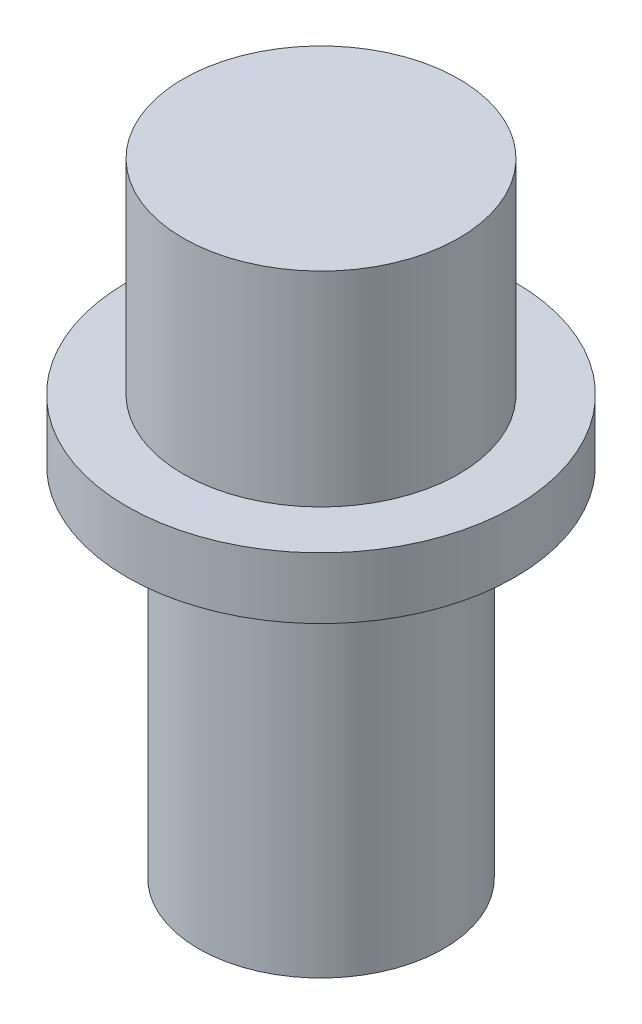
from build123d import *

# Parameters (mm, degrees)
SKETCH1_R           = 12
BOSS_EXTRUDE1_DEPTH = 35
SKETCH2_R           = 19
BOSS_EXTRUDE2_DEPTH = 6
SKETCH3_R           = 13.5
BOSS_EXTRUDE3_DEPTH = 20


with BuildPart() as part:
    # Sketch1 → Boss-Extrude1 (new body)
    with BuildSketch(Plane(origin=(0, 0, 0), x_dir=(1, 0, 0), z_dir=(0, 1, 0))):
        Circle(SKETCH1_R)
    extrude(amount=BOSS_EXTRUDE1_DEPTH)

    # Sketch2 → Boss-Extrude2 (add)
    with BuildSketch(Plane(origin=(0, 35, 0), x_dir=(1, 0, 0), z_dir=(0, 1, 0))):
        Circle(SKETCH2_R)
    extrude(amount=BOSS_EXTRUDE2_DEPTH)

    # Sketch3 → Boss-Extrude3 (add)
    with BuildSketch(Plane(origin=(0, 41, 0), x_dir=(1, 0, 0), z_dir=(0, 1, 0))):
        Circle(SKETCH3_R)
    extrude(amount=BOSS_EXTRUDE3_DEPTH)


solid = part.part
